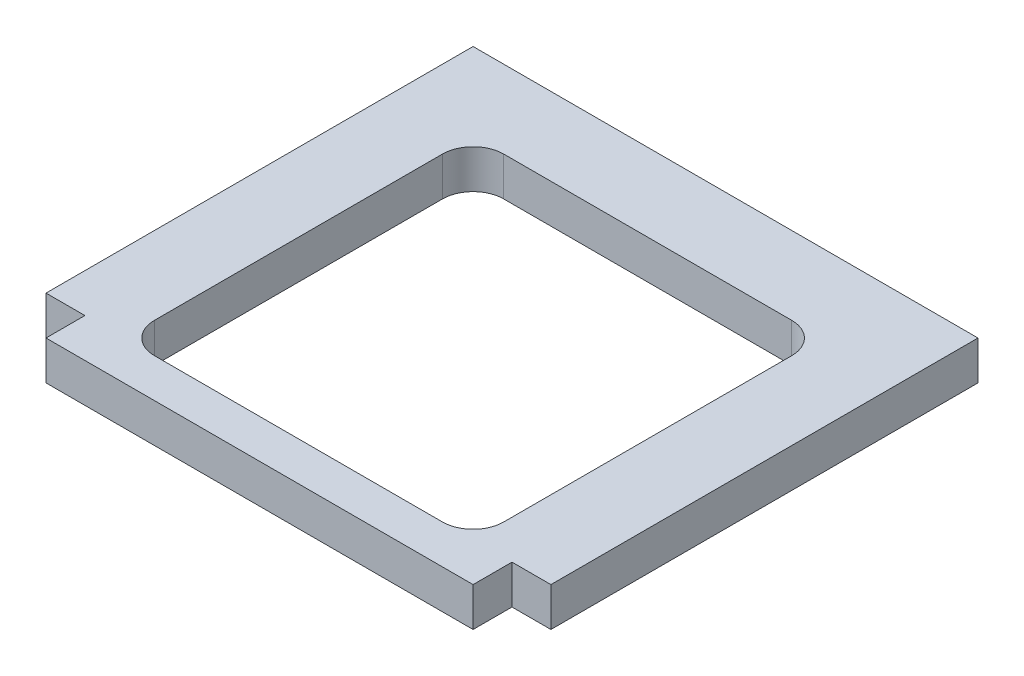
from build123d import *

# Parameters (mm, degrees)
BOSS_EXTRUDE1_DEPTH = 6.35


with BuildPart() as part:
    # Sketch1 → Boss-Extrude1 (new body)
    with BuildSketch(Plane(origin=(0, 0, 0), x_dir=(1, 0, 0), z_dir=(0, 1, 0))):
        Polygon((-41.2, -28.5), (-41.2, 41.2), (41.2, 41.2), (41.2, -28.5), (34.85, -28.5), (34.85, -34.85), (-34.85, -34.85), (-34.85, -28.5), align=None)
        with BuildLine():
            Line((-23.5, -28.5), (23.5, -28.5))
            ThreePointArc((23.5, -28.5), (27.035533906, -27.035533906), (28.5, -23.5))
            Line((28.5, -23.5), (28.5, 23.5))
            ThreePointArc((28.5, 23.5), (27.035533906, 27.035533906), (23.5, 28.5))
            Line((23.5, 28.5), (-23.5, 28.5))
            ThreePointArc((-23.5, 28.5), (-27.035533906, 27.035533906), (-28.5, 23.5))
            Line((-28.5, 23.5), (-28.5, -23.5))
            ThreePointArc((-28.5, -23.5), (-27.035533906, -27.035533906), (-23.5, -28.5))
        make_face(mode=Mode.SUBTRACT)
    extrude(amount=BOSS_EXTRUDE1_DEPTH)


solid = part.part
